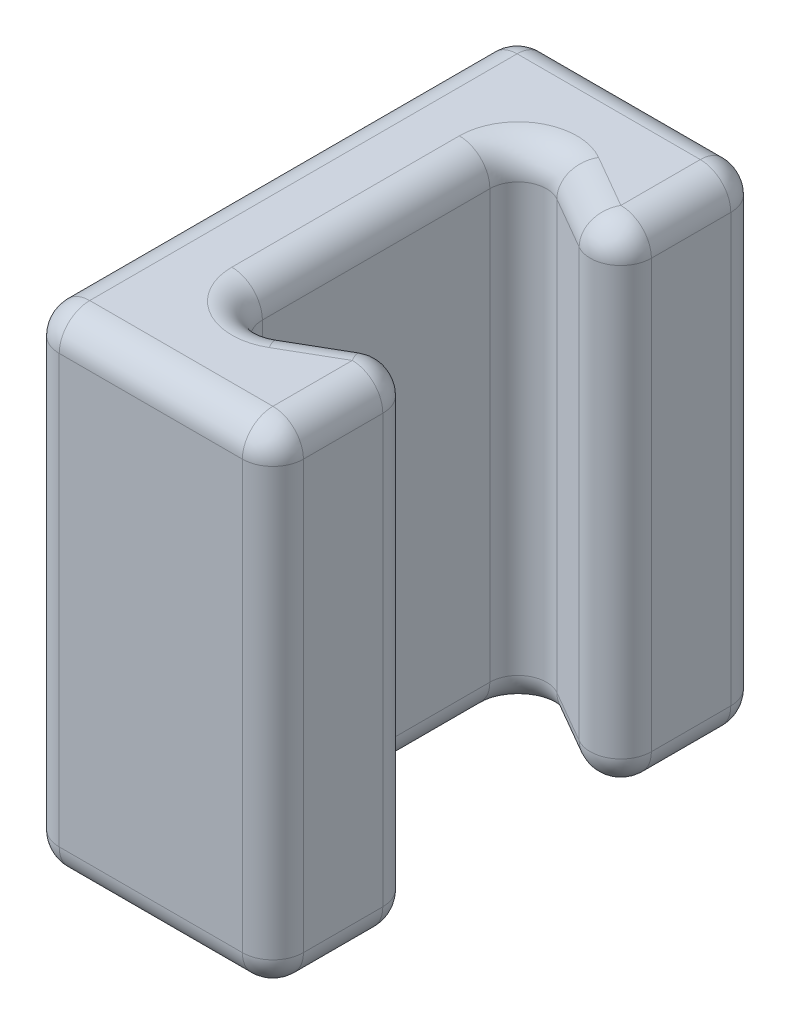
from build123d import *
from OCP.BRepFilletAPI import BRepFilletAPI_MakeFillet

# Parameters (mm, degrees)
BOSS_EXTRUDE2_DEPTH = 25.4
FILLET1_R1          = 1.5875
FILLET1_R2          = 1.4732


with BuildPart() as part:
    # Sketch1 → Boss-Extrude2 (new body)
    with BuildSketch(Plane(origin=(0, 0, 0), x_dir=(1, 0, 0), z_dir=(0, 1, 0))):
        Polygon((-28.067579909, 0), (-28.067579909, -25.4), (-15.367579909, -25.4), (-15.367579909, -16.933333333), (-22.699928279, -21.166666582), (-22.699928279, -4.233333249), (-15.367579909, -8.466666667), (-15.367579909, 0), align=None)
    extrude(amount=BOSS_EXTRUDE2_DEPTH)

    # Fillet1: one fillet with a radius per group of edges: ONE call of the kernel's fillet builder (fillet() takes one radius for all edges)
    fillet1_edges_1 = [part.edges().sort_by_distance(p)[0] for p in [
        (-19.033754094, 25.4, 6.349999958),
        (-22.699928279, 25.4, 12.699999915),
        (-19.033754094, 25.4, 19.049999958),
        (-15.367579909, 25.4, 21.166666667),
        (-15.367579909, 25.4, 4.233333333),
        (-21.717579909, 25.4, 0),
        (-28.067579909, 12.7, 0),
        (-15.367579909, 12.7, 0),
        (-21.717579909, 0, 0),
        (-15.367579909, 0, 4.233333333),
        (-15.367579909, 12.7, 8.466666667),
        (-15.367579909, 12.7, 16.933333333),
        (-15.367579909, 0, 21.166666667),
        (-15.367579909, 12.7, 25.4),
        (-22.699928279, 0, 12.699999915),
        (-28.067579909, 25.4, 12.7),
        (-21.717579909, 25.4, 25.4),
        (-28.067579909, 12.7, 25.4),
        (-28.067579909, 0, 12.7),
        (-21.717579909, 0, 25.4),
        (-19.033754094, 0, 6.349999958),
        (-19.033754094, 0, 19.049999958),
    ]]
    fillet1_edges_2 = [part.edges().sort_by_distance(p)[0] for p in [
        (-22.699928279, 12.7, 4.233333249),
        (-22.699928279, 12.7, 21.166666582),
    ]]
    fillet1 = BRepFilletAPI_MakeFillet(part.part.solid().wrapped)
    for e in fillet1_edges_1:
        fillet1.Add(FILLET1_R1, e.wrapped)
    for e in fillet1_edges_2:
        fillet1.Add(FILLET1_R2, e.wrapped)
    add(Compound.cast(fillet1.Shape()), mode=Mode.REPLACE)


solid = part.part
